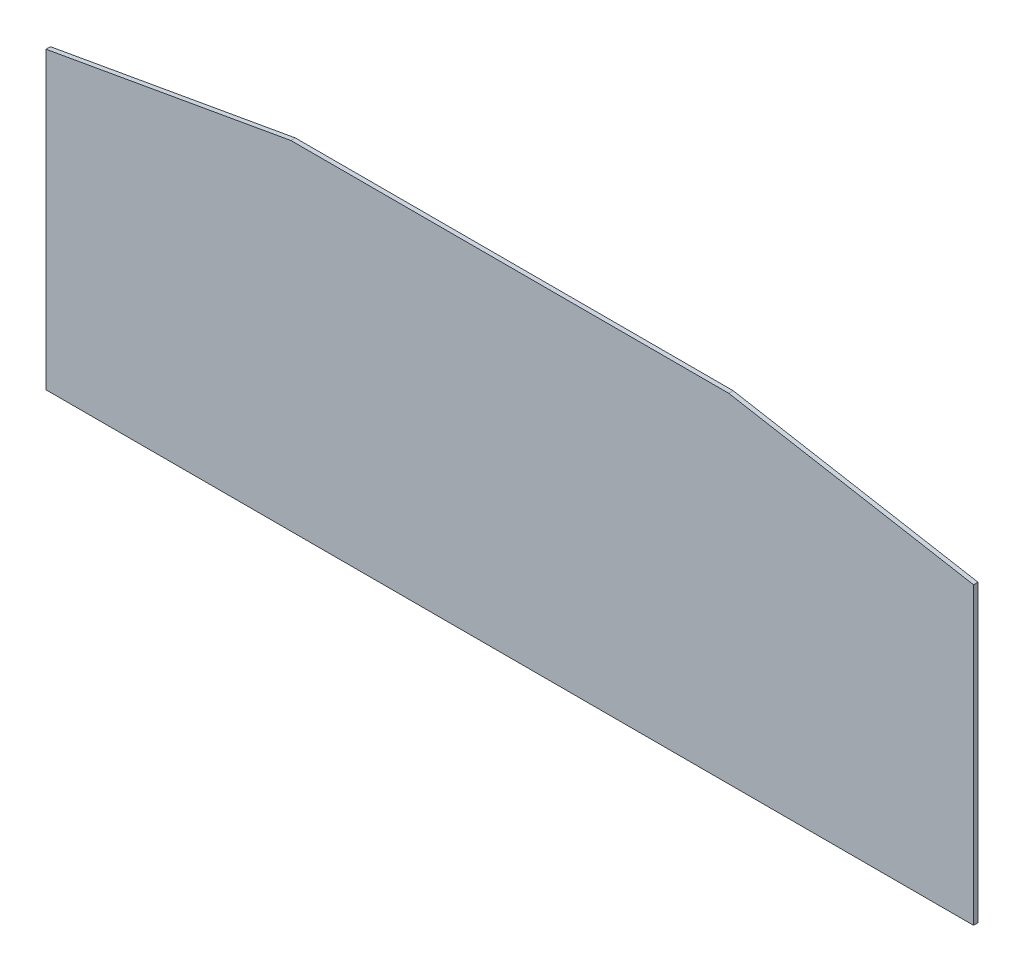
from build123d import *

# Parameters (mm, degrees)
TABAN_FLAN_1_DEPTH = 12


# Sheet-metal steps are written as plain solids
with BuildPart() as part:
    # Çizim1 → Taban-Flanş1 (new body)
    with BuildSketch(Plane.XY):
        Polygon((0, 0), (0, 795), (660, 912), (1840, 912), (2500, 795), (2500, 0), align=None)
    extrude(amount=-TABAN_FLAN_1_DEPTH)


solid = part.part
